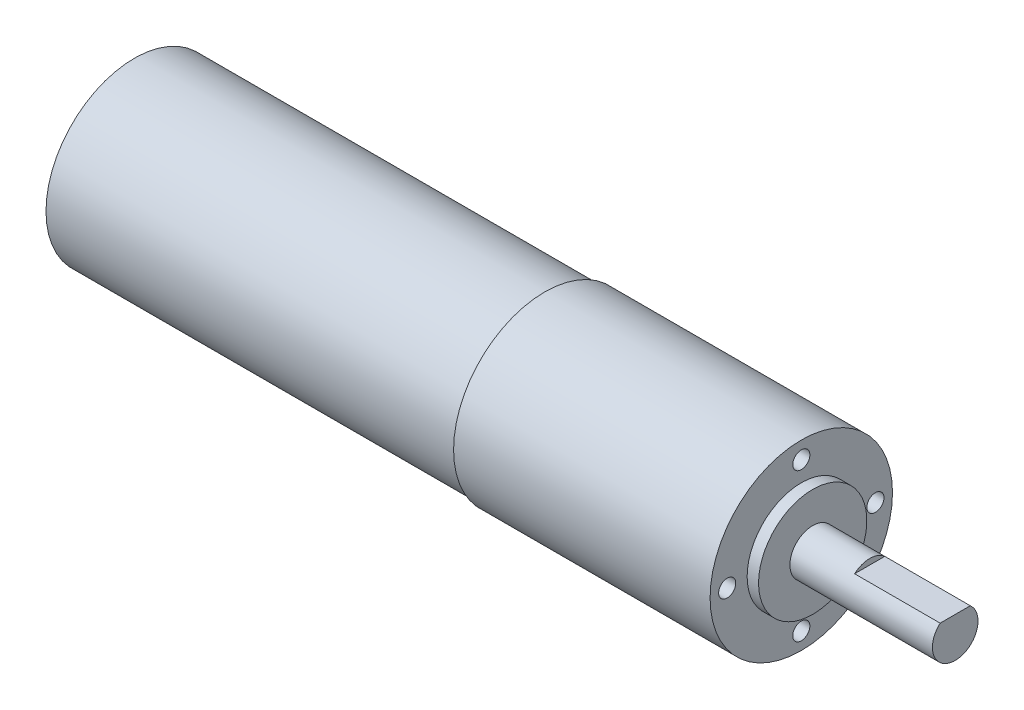
from build123d import *

# Parameters (mm, degrees)
CUT_EXTRUDE1_DEPTH = 15
SKETCH3_R          = 1.5
CUT_EXTRUDE2_DEPTH = 5


with BuildPart() as part:
    # Sketch1 → Revolve1 (revolve)
    with BuildSketch(Plane.XY):
        Polygon((0, 0), (0, 15.5), (72, 15.5), (72, 16), (117, 16), (117, 9.5), (119, 9.5), (119, 4), (144, 4), (144, 0), align=None)
    revolve(axis=Axis((0, 0, 0), (1, 0, 0)))

    # Sketch2 → Cut-Extrude1 (cut)
    with BuildSketch(Plane(origin=(144, 0, 0), x_dir=(0, 0, -1), z_dir=(1, 0, 0))):
        with BuildLine():
            Line((-2.645751311, 3), (2.645751311, 3))
            ThreePointArc((2.645751311, 3), (0, 4), (-2.645751311, 3))
        make_face()
    extrude(amount=-CUT_EXTRUDE1_DEPTH, mode=Mode.SUBTRACT)

    # Sketch3 → Cut-Extrude2 (cut)
    with BuildSketch(Plane(origin=(117, 0, 0), x_dir=(0, 0, -1), z_dir=(1, 0, 0))):
        with Locations((0, 13)):
            Circle(SKETCH3_R)
        with Locations((13, 0)):
            Circle(SKETCH3_R)
        with Locations((0, -13)):
            Circle(SKETCH3_R)
        with Locations((-13, 0)):
            Circle(SKETCH3_R)
    extrude(amount=-CUT_EXTRUDE2_DEPTH, mode=Mode.SUBTRACT)


solid = part.part
